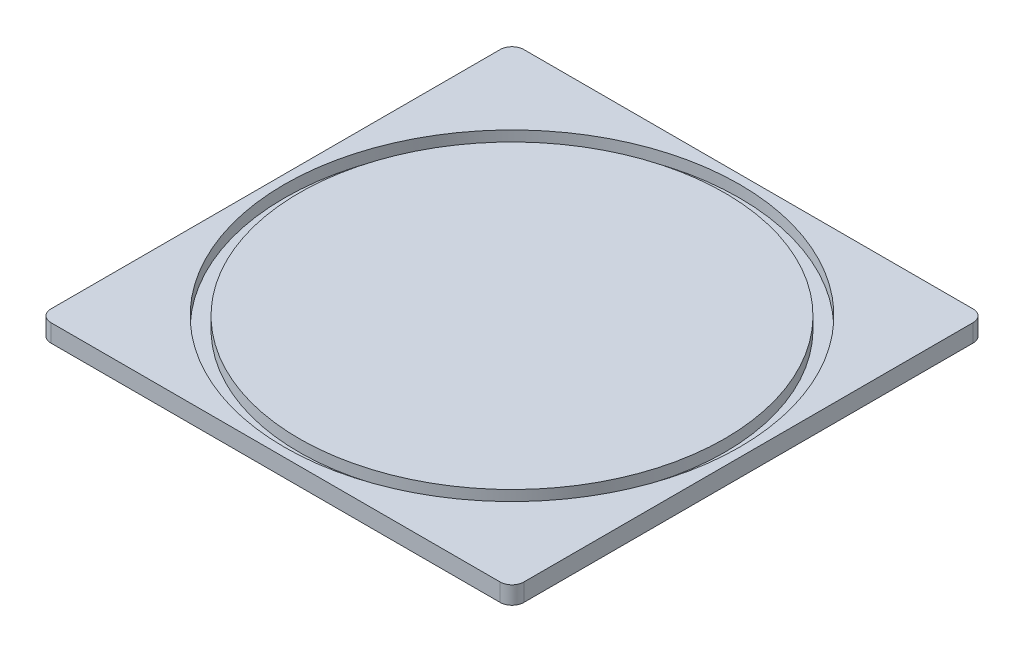
from build123d import *

# Parameters (mm, degrees)
SKETCH1_W               = 80
SKETCH1_H               = 80
BOSS_EXTRUDE1_DEPTH     = 3
SKETCH3_R               = 38.5
SKETCH3_R_2             = 36
CUT_EXTRUDE_THIN1_DEPTH = 2
FILLET1_R               = 2


with BuildPart() as part:
    # Sketch1 → Boss-Extrude1 (new body)
    with BuildSketch(Plane(origin=(0, 0, 0), x_dir=(1, 0, 0), z_dir=(0, 1, 0))):
        with Locations((40, 0)):
            Rectangle(SKETCH1_W, SKETCH1_H)
    extrude(amount=BOSS_EXTRUDE1_DEPTH)

    # Sketch3 → Cut-Extrude-Thin1 (cut)
    with BuildSketch(Plane(origin=(0, 3, 0), x_dir=(1, 0, 0), z_dir=(0, 1, 0))):
        with Locations((40, 0)):
            Circle(SKETCH3_R)
        with Locations((40, 0)):
            Circle(SKETCH3_R_2, mode=Mode.SUBTRACT)
    extrude(amount=-CUT_EXTRUDE_THIN1_DEPTH, mode=Mode.SUBTRACT)

    # Fillet1
    fillet1_edges = [part.edges().sort_by_distance(p)[0] for p in [
        (0, 1.5, -40),
        (0, 1.5, 40),
        (80, 1.5, -40),
        (80, 1.5, 40),
    ]]
    fillet(fillet1_edges, radius=FILLET1_R)


solid = part.part
